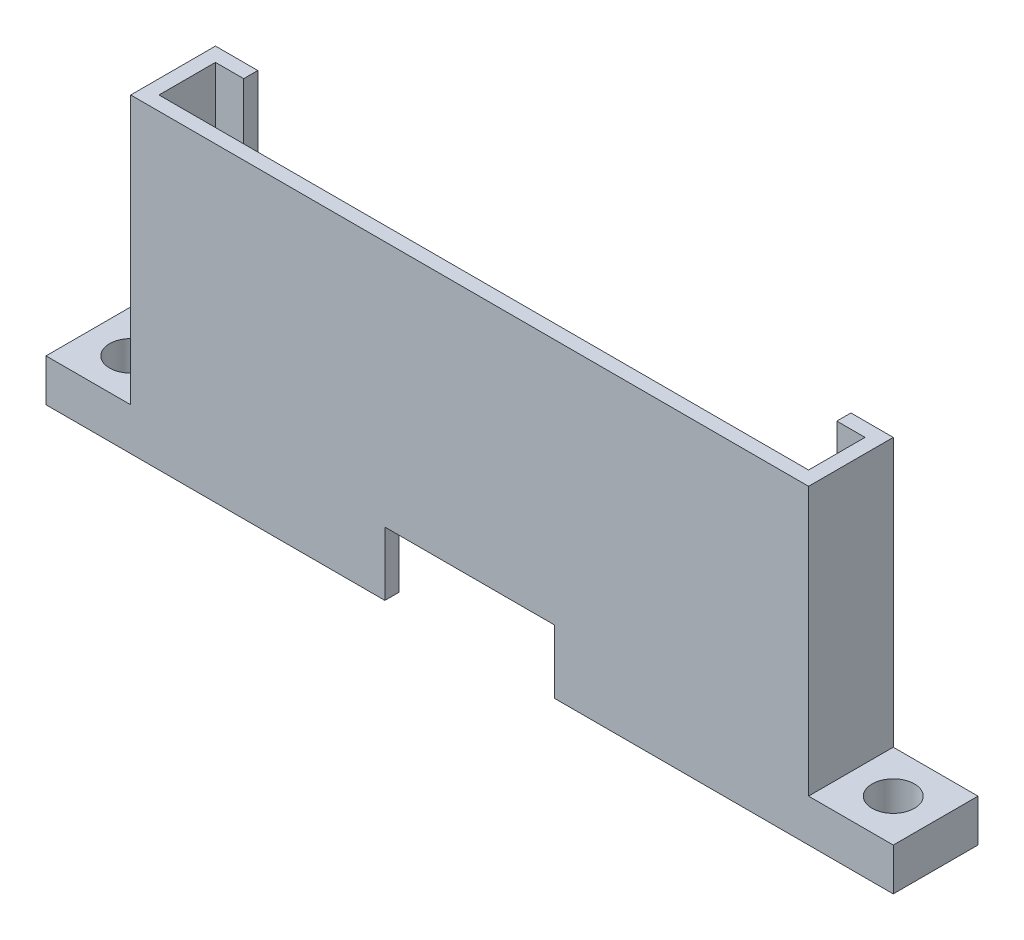
from build123d import *

# Parameters (mm, degrees)
SKETCH_1_W          = 48
SKETCH_1_H          = 22
EXTRUDE_1_DEPTH     = 6
SKETCH_4_W          = 46
SKETCH_4_H          = 4
CUT_EXTRUDE_2_DEPTH = 22
SKETCH_5_W          = 42
SKETCH_5_H          = 1
CUT_EXTRUDE_3_DEPTH = 22
SKETCH_9_W          = 12
SKETCH_9_H          = 4.5
CUT_EXTRUDE_5_DEPTH = 6
SKETCH_10_W         = 6
SKETCH_10_H         = 3
EXTRUDE_2_DEPTH     = 6
SKETCH_11_W         = 6
SKETCH_11_H         = 3
EXTRUDE_3_DEPTH     = 6
SKETCH_12_R         = 1.5
CUT_EXTRUDE_6_DEPTH = 3
SKETCH_14_R         = 1.5
CUT_EXTRUDE_7_DEPTH = 3


with BuildPart() as part:
    # 草圖1 → 填料-伸長1 (new body)
    with BuildSketch(Plane.XY):
        with Locations((-24, -11)):
            Rectangle(SKETCH_1_W, SKETCH_1_H)
    extrude(amount=EXTRUDE_1_DEPTH)

    # 草圖4 → 除料-伸長2 (cut)
    with BuildSketch(Plane(origin=(0, 0, 0), x_dir=(1, 0, 0), z_dir=(0, 1, 0))):
        with Locations((-24, -3)):
            Rectangle(SKETCH_4_W, SKETCH_4_H)
    extrude(amount=-CUT_EXTRUDE_2_DEPTH, mode=Mode.SUBTRACT)

    # 草圖5 → 除料-伸長3 (cut)
    with BuildSketch(Plane(origin=(0, 0, 0), x_dir=(1, 0, 0), z_dir=(0, 1, 0))):
        with Locations((-24, -0.5)):
            Rectangle(SKETCH_5_W, SKETCH_5_H)
    extrude(amount=-CUT_EXTRUDE_3_DEPTH, mode=Mode.SUBTRACT)

    # 草圖9 → 除料-伸長5 (cut)
    with BuildSketch(Plane.XY.offset(6)):
        with Locations((-24, -19.75)):
            Rectangle(SKETCH_9_W, SKETCH_9_H)
    extrude(amount=-CUT_EXTRUDE_5_DEPTH, mode=Mode.SUBTRACT)

    # 草圖10 → 填料-伸長2 (add)
    with BuildSketch(Plane(origin=(0, 0, 0), x_dir=(0, 0, -1), z_dir=(1, 0, 0))):
        with Locations((-3, -20.5)):
            Rectangle(SKETCH_10_W, SKETCH_10_H)
    extrude(amount=EXTRUDE_2_DEPTH)

    # 草圖11 → 填料-伸長3 (add)
    with BuildSketch(Plane.ZY.offset(48)):
        with Locations((3, -20.5)):
            Rectangle(SKETCH_11_W, SKETCH_11_H)
    extrude(amount=EXTRUDE_3_DEPTH)

    # 草圖12 → 除料-伸長6 (cut)
    with BuildSketch(Plane(origin=(0, -19, 0), x_dir=(1, 0, 0), z_dir=(0, 1, 0))):
        with Locations((3, -3)):
            Circle(SKETCH_12_R)
    extrude(amount=-CUT_EXTRUDE_6_DEPTH, mode=Mode.SUBTRACT)

    # 草圖14 → 除料-伸長7 (cut)
    with BuildSketch(Plane(origin=(0, -19, 0), x_dir=(1, 0, 0), z_dir=(0, 1, 0))):
        with Locations((-51, -3)):
            Circle(SKETCH_14_R)
    extrude(amount=-CUT_EXTRUDE_7_DEPTH, mode=Mode.SUBTRACT)


solid = part.part
